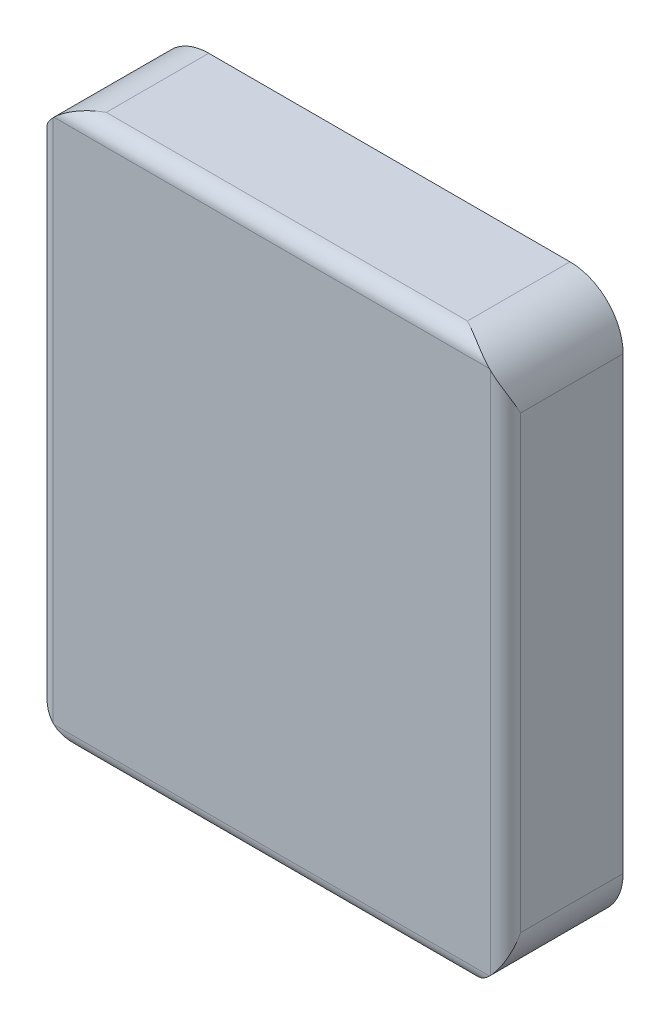
from build123d import *

# Parameters (mm, degrees)
SKETCH1_W                      = 61.6
SKETCH1_H                      = 73.3
BOSS_EXTRUDE1_DEPTH            = 15.5
SKETCH2_W                      = 58.544
SKETCH2_H                      = 70.244
BOSS_EXTRUDE2_DEPTH            = 1
CUT_EXTRUDE1_DEPTH             = 1
CUT_EXTRUDE2_DEPTH             = 5.5
CUT_EXTRUDE3_DEPTH             = 8
SKETCH6_W                      = 1.1
SKETCH6_H                      = 18.4
CUT_EXTRUDE4_DEPTH             = 9.3
SKETCH7_W                      = 1.1
SKETCH7_H                      = 18.4
CUT_EXTRUDE5_DEPTH             = 9.3
F_2_2_2_2_DIAMETER_HOLE1_D     = 2.2
F_2_2_2_2_DIAMETER_HOLE1_DEPTH = 7.6
FILLET1_R                      = 2
FILLET2_R                      = 4.871984114
FILLET3_R                      = 5.472
FILLET4_R                      = 7


with BuildPart() as part:
    # Sketch1 → Boss-Extrude1 (new body)
    with BuildSketch(Plane(origin=(0, 0, 0.5), x_dir=(-1, 0, 0), z_dir=(0, 0, -1))):
        with Locations((-23.1, -18.15)):
            Rectangle(SKETCH1_W, SKETCH1_H)
    extrude(amount=-BOSS_EXTRUDE1_DEPTH)

    # Sketch2 → Boss-Extrude2 (add)
    with BuildSketch(Plane(origin=(0, 0, 0.5), x_dir=(-1, 0, 0), z_dir=(0, 0, -1))):
        with Locations((-23.1, -18.15)):
            Rectangle(SKETCH2_W, SKETCH2_H)
    extrude(amount=BOSS_EXTRUDE2_DEPTH)

    # Sketch3 → Cut-Extrude1 (cut)
    with BuildSketch(Plane(origin=(0, 0, -0.5), x_dir=(-1, 0, 0), z_dir=(0, 0, -1))):
        with BuildLine():
            Line((-51.771984114, 16.371984114), (-51.771984114, -35.734235116))
            Line((-51.771984114, -35.734235116), (-49.52987247, -35.734235116))
            Line((-49.52987247, -35.734235116), (-49.52987247, -51.901219331))
            ThreePointArc((-49.52987247, -51.901219331), (-48.270247018, -52.475323766), (-46.9, -52.671984114))
            Line((-46.9, -52.671984114), (0.7, -52.671984114))
            ThreePointArc((0.7, -52.671984114), (2.070247018, -52.475323766), (3.32987247, -51.901219331))
            Line((3.32987247, -51.901219331), (3.32987247, -35.734235116))
            Line((3.32987247, -35.734235116), (5.571984114, -35.734235116))
            Line((5.571984114, -35.734235116), (5.571984114, 16.371984114))
            Line((5.571984114, 16.371984114), (-51.771984114, 16.371984114))
        make_face()
    extrude(amount=-CUT_EXTRUDE1_DEPTH, mode=Mode.SUBTRACT)

    # Sketch4 → Cut-Extrude2 (cut)
    with BuildSketch(Plane(origin=(0, 0, 0.5), x_dir=(-1, 0, 0), z_dir=(0, 0, -1))):
        Polygon((3, -14.8), (4.7, -14.8), (4.7, 15.5), (-50.9, 15.5), (-50.9, -14.8), (-49.2, -14.8), (-49.2, -31.8), (-45.2, -31.8), (-45.2, -50.2), (-1, -50.2), (-1, -31.8), (3, -31.8), align=None)
    extrude(amount=-CUT_EXTRUDE2_DEPTH, mode=Mode.SUBTRACT)

    # Sketch5 → Cut-Extrude3 (cut)
    with BuildSketch(Plane(origin=(0, 0, 6), x_dir=(-1, 0, 0), z_dir=(0, 0, -1))):
        Polygon((3, -12.7), (-1, -12.7), (-1, -11.5), (4.7, -11.5), (4.7, 15.5), (-50.9, 15.5), (-50.9, -11.5), (-45.2, -11.5), (-45.2, -12.7), (-49.2, -12.7), (-49.2, -31.8), (-45.2, -31.8), (-45.2, -50.2), (-1, -50.2), (-1, -31.8), (3, -31.8), align=None)
    extrude(amount=-CUT_EXTRUDE3_DEPTH, mode=Mode.SUBTRACT)

    # Sketch6 → Cut-Extrude4 (cut)
    with BuildSketch(Plane(origin=(0, 0, 0.5), x_dir=(-1, 0, 0), z_dir=(0, 0, -1))):
        with Locations((-45.75, -41)):
            Rectangle(SKETCH6_W, SKETCH6_H)
    extrude(amount=-CUT_EXTRUDE4_DEPTH, mode=Mode.SUBTRACT)

    # Sketch7 → Cut-Extrude5 (cut)
    with BuildSketch(Plane(origin=(0, 0, 0.5), x_dir=(-1, 0, 0), z_dir=(0, 0, -1))):
        with Locations((-0.45, -41)):
            Rectangle(SKETCH7_W, SKETCH7_H)
    extrude(amount=-CUT_EXTRUDE5_DEPTH, mode=Mode.SUBTRACT)

    # Ø2.2 (2.2) Diameter Hole1
    with Locations(Plane(origin=(-0.1, 0, 0), x_dir=(0, 0, -1), z_dir=(1, 0, 0))):
        with Locations((-5, -41.2)):
            Hole(F_2_2_2_2_DIAMETER_HOLE1_D / 2, depth=F_2_2_2_2_DIAMETER_HOLE1_DEPTH)

    # Fillet1
    fillet1_edges = [part.edges().sort_by_distance(p)[0] for p in [
        (23.1, -54.8, 16),
        (-7.7, -18.15, 16),
        (23.1, 18.5, 16),
        (50.9, 15.5, 7.25),
        (-4.7, 15.5, 7.25),
        (53.9, -18.15, 16),
    ]]
    fillet(fillet1_edges, radius=FILLET1_R)

    # Fillet2
    fillet2_edges = [part.edges().sort_by_distance(p)[0] for p in [
        (51.771984114, 16.371984114, 0),
        (-5.571984114, 16.371984114, 0),
    ]]
    fillet(fillet2_edges, radius=FILLET2_R)

    # Fillet3
    fillet3_edges = [part.edges().sort_by_distance(p)[0] for p in [
        (52.372, 16.972, 0),
        (52.372, -53.272, 0),
        (-6.172, -53.272, 0),
        (-6.172, 16.972, 0),
    ]]
    fillet(fillet3_edges, radius=FILLET3_R)

    # Fillet4
    # the kernel refuses this fillet: 7 mm, written as the material it takes off along each edge
    with BuildSketch(Plane(origin=(-7.7, -54.8, -17), x_dir=(1, 0, 0), z_dir=(0, 0, 1)), Plane(origin=(53.9, -54.8, -17), x_dir=(0, 1, 0), z_dir=(0, 0, 1))) as fillet4_piece_1:
        with BuildLine():
            CenterArc((FILLET4_R, FILLET4_R), FILLET4_R, 180, 90)
            Line((0, FILLET4_R), (0, 0))
            Line((0, 0), (FILLET4_R, 0))
        make_face()
    extrude(amount=48.5, mode=Mode.SUBTRACT)
    with BuildSketch(Plane(origin=(-7.7, 18.5, -17), x_dir=(1, 0, 0), z_dir=(0, 0, 1)), Plane(origin=(53.9, 18.5, -17), x_dir=(0, -1, 0), z_dir=(0, 0, 1))) as fillet4_piece_2:
        with BuildLine():
            CenterArc((FILLET4_R, -FILLET4_R), FILLET4_R, 90, 90)
            Line((0, -FILLET4_R), (0, 0))
            Line((0, 0), (FILLET4_R, 0))
        make_face()
    extrude(amount=48.5, mode=Mode.SUBTRACT)


solid = part.part
